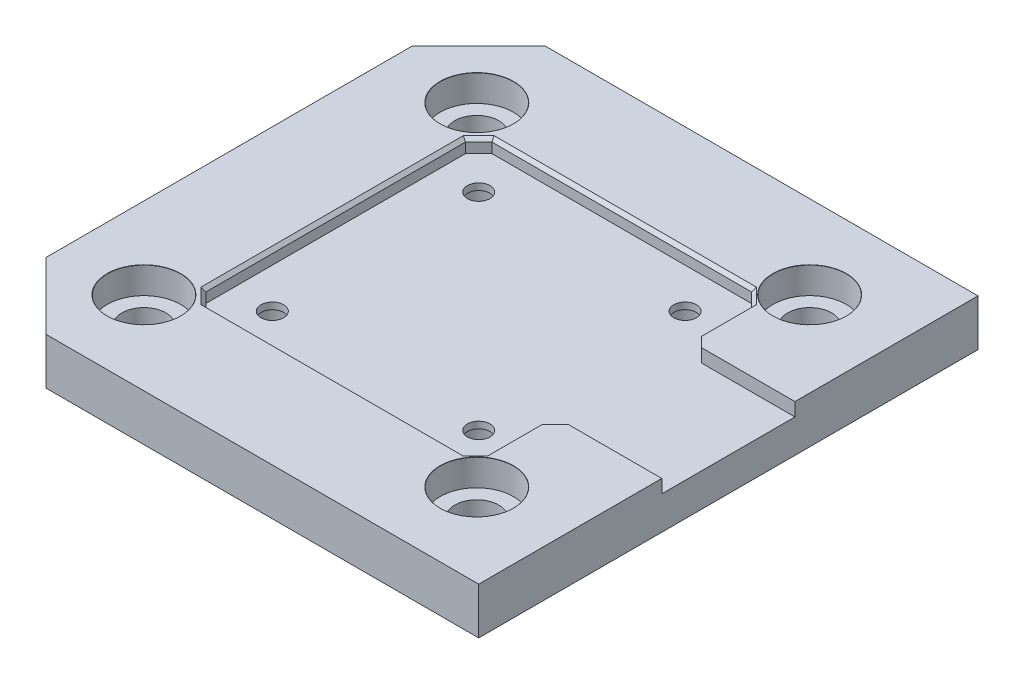
from build123d import *

# Parameters (mm, degrees)
BOSS_EXTRUDE1_DEPTH = 7
HOLE3_AT_2_COUNT    = 2
HOLE3_AT_2_PITCH    = 50
HOLE3_AT_3_COUNT    = 2
HOLE3_AT_3_PITCH    = 70.710678119
HOLE3_AT_4_COUNT    = 2
HOLE3_AT_4_PITCH    = 50
CUT_EXTRUDE3_DEPTH  = 2
HOLE2_AT_2_COUNT    = 2
HOLE2_AT_2_PITCH    = 31
HOLE2_AT_3_COUNT    = 2
HOLE2_AT_3_PITCH    = 43.840620434
HOLE2_AT_4_COUNT    = 2
HOLE2_AT_4_PITCH    = 31
CHAMFER1_SIZE       = 0.5
CHAMFER2_SIZE       = 10


with BuildPart() as part:
    # Sketch1 → Boss-Extrude1 (new body)
    with BuildSketch(Plane(origin=(0, 0, 0), x_dir=(1, 0, 0), z_dir=(0, 1, 0))):
        Polygon((0, 37.5), (-37.5, 37.5), (-37.5, -37.5), (0, -37.5), (37.5, -37.5), (37.5, 37.5), align=None)
    extrude(amount=BOSS_EXTRUDE1_DEPTH)

    # Sketch14 → Hole3 (revolve, cut)
    with BuildSketch(Plane(origin=(-25.29, 7, 25), x_dir=(0, 0, 1), z_dir=(1, 0, 0))):
        Polygon((0, 0), (0, 7), (3.325, 7), (3.3, 6.975), (3.3, 4), (5.5, 4), (5.5, 0.025), (5.525, 0), align=None)
    hole3 = revolve(axis=Axis((-25.29, 13.35, 25), (0, -1, 0)), mode=Mode.SUBTRACT)

    # Hole3 at 2: Hole3 ×2
    with Locations(*[(0, 0, -i * HOLE3_AT_2_PITCH) for i in range(1, HOLE3_AT_2_COUNT)]):
        add(hole3, mode=Mode.SUBTRACT)

    # Hole3 at 3: Hole3 ×2
    with Locations(*[Vector(0.7071067811865476, 0, -0.7071067811865476) * (i * HOLE3_AT_3_PITCH) for i in range(1, HOLE3_AT_3_COUNT)]):
        add(hole3, mode=Mode.SUBTRACT)

    # Hole3 at 4: Hole3 ×2
    with Locations(*[(i * HOLE3_AT_4_PITCH, 0, 0) for i in range(1, HOLE3_AT_4_COUNT)]):
        add(hole3, mode=Mode.SUBTRACT)

    # Sketch9 → Cut-Extrude3 (cut)
    with BuildSketch(Plane(origin=(0, 7, 0), x_dir=(1, 0, 0), z_dir=(0, 1, 0))):
        Polygon((21.5, 19.5), (19.5, 21.5), (-19.5, 21.5), (-21.5, 19.5), (-21.5, -19.5), (-19.5, -21.5), (19.5, -21.5), (21.5, -19.5), (21.5, -12), (23.5, -10), (37.5, -10), (37.5, 0), (37.5, 10), (23.5, 10), (21.5, 12), align=None)
    extrude(amount=-CUT_EXTRUDE3_DEPTH, mode=Mode.SUBTRACT)

    # Sketch12 → Hole2 (revolve, cut)
    with BuildSketch(Plane(origin=(-15.5, 0, -15.5), x_dir=(0, 0, -1), z_dir=(1, 0, 0))):
        Polygon((0, 0), (0, 7), (1.725, 7), (1.7, 6.975), (1.7, 4), (3.25, 4), (3.25, 0.025), (3.275, 0), align=None)
    hole2 = revolve(axis=Axis((-15.5, -6.35, -15.5), (0, 1, 0)), mode=Mode.SUBTRACT)

    # Hole2 at 2: Hole2 ×2
    with Locations(*[(i * HOLE2_AT_2_PITCH, 0, 0) for i in range(1, HOLE2_AT_2_COUNT)]):
        add(hole2, mode=Mode.SUBTRACT)

    # Hole2 at 3: Hole2 ×2
    with Locations(*[Vector(0.7071067811865476, 0, 0.7071067811865475) * (i * HOLE2_AT_3_PITCH) for i in range(1, HOLE2_AT_3_COUNT)]):
        add(hole2, mode=Mode.SUBTRACT)

    # Hole2 at 4: Hole2 ×2
    with Locations(*[(0, 0, i * HOLE2_AT_4_PITCH) for i in range(1, HOLE2_AT_4_COUNT)]):
        add(hole2, mode=Mode.SUBTRACT)

    # Chamfer1
    chamfer1_edges = [part.edges().sort_by_distance(p)[0] for p in [
        (20.5, 7, 20.5),
        (21.5, 7, -15.75),
        (20.5, 7, -20.5),
        (0, 7, 21.5),
        (-20.5, 7, 20.5),
        (-21.5, 7, 0),
        (-20.5, 7, -20.5),
        (0, 7, -21.5),
    ]]
    chamfer(chamfer1_edges, length=CHAMFER1_SIZE)

    # Chamfer2
    chamfer2_edges = [part.edges().sort_by_distance(p)[0] for p in [
        (-37.5, 3.5, 37.5),
        (-37.5, 3.5, -37.5),
    ]]
    chamfer(chamfer2_edges, length=CHAMFER2_SIZE)


solid = part.part
